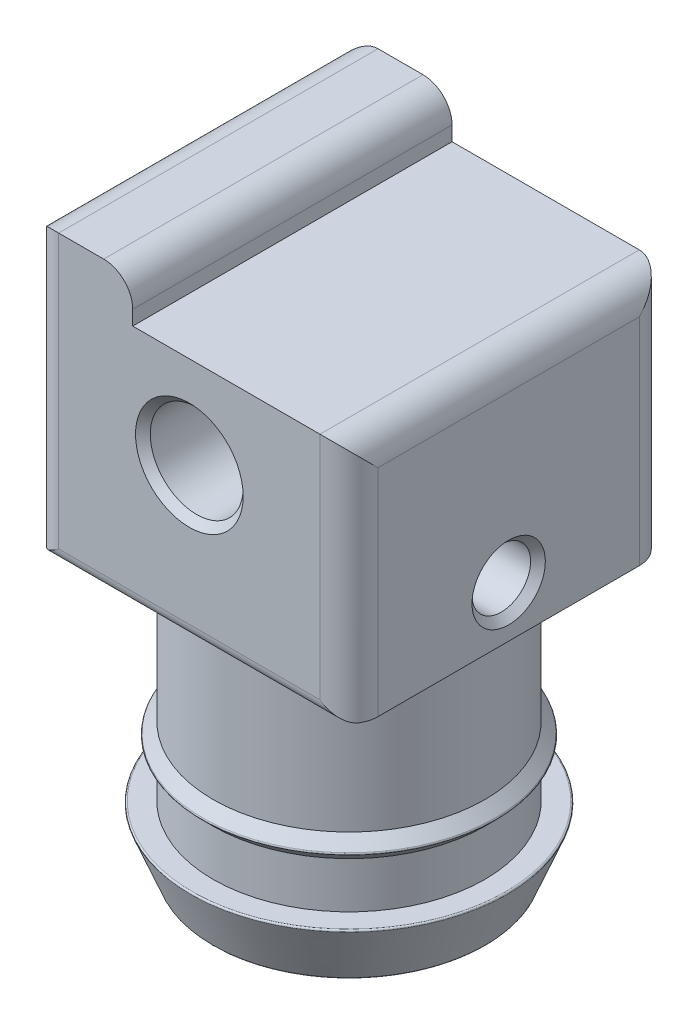
from build123d import *

# Parameters (mm, degrees)
SKETCH1_R                   = 3.2
BOSS_EXTRUDE1_DEPTH         = 11
SKETCH3_R                   = 2.38125
CUT_EXTRUDE1_DEPTH          = 25
F_10_32_TAPPED_HOLE1_REACH  = 40.409
F_10_32_TAPPED_HOLE1_BORE_R = 2.0193
FILLET3_R                   = 0.09921875
CHAMFER1_SIZE               = 0.508
FILLET6_R                   = 1
SKETCH6_W                   = 7.1
SKETCH6_H                   = 22
BOSS_EXTRUDE2_DEPTH         = 3
FILLET7_R                   = 2
FILLET8_R                   = 2


with BuildPart() as part:
    # Sketch1 → Boss-Extrude1 (new, symmetric)
    # profile 1 of 3: a face of its own
    with BuildSketch(Plane.XY):
        with BuildLine():
            Line((-11, 6.35), (-11, 0))
            Line((-11, 0), (-6.35, 0))
            ThreePointArc((-6.35, 0), (-4.49012806, 4.490128061), (2e-09, 6.35))
            Line((2e-09, 6.35), (-11, 6.35))
        make_face()
    # profile 2 of 3: a face of its own
    with BuildSketch(Plane.XY):
        with BuildLine():
            Line((-6.35, 0), (-11, 0))
            Line((-11, 0), (-11, -10.5))
            Line((-11, -10.5), (11, -10.5))
            Line((11, -10.5), (11, 0))
            Line((11, 0), (6.35, 0))
            ThreePointArc((6.35, 0), (4.490128061, 4.49012806), (2e-09, 6.35))
            ThreePointArc((2e-09, 6.35), (-4.49012806, 4.490128061), (-6.35, 0))
        make_face()
        Circle(SKETCH1_R, mode=Mode.SUBTRACT)
    # profile 3 of 3: a face of its own
    with BuildSketch(Plane.XY):
        with BuildLine():
            Line((11, 6.35), (2e-09, 6.35))
            ThreePointArc((2e-09, 6.35), (4.490128061, 4.49012806), (6.35, 0))
            Line((6.35, 0), (11, 0))
            Line((11, 0), (11, 6.35))
        make_face()
    extrude(amount=BOSS_EXTRUDE1_DEPTH, both=True)

    # Sketch2 → Revolve1 (revolve)
    with BuildSketch(Plane.XY, mode=Mode.PRIVATE) as revolve1_sk:
        Polygon((0, -10), (9.365, -10), (9.365, -20.76875), (10.15875, -21.5625), (9.365, -22.35625), (9.365, -25.53125), (10.9525, -25.53125), (9.365, -29.5), (0, -29.5), align=None)
    revolve(revolve1_sk.sketch.rotate(Axis((0, 9.54404991, 0), (0, -1, 0)), 180), axis=Axis((0, 9.54404991, 0), (0, -1, 0)))

    # Sketch3 → Cut-Extrude1 (cut)
    with BuildSketch(Plane.XZ.offset(29.5)):
        Circle(SKETCH3_R)
    extrude(amount=-CUT_EXTRUDE1_DEPTH, mode=Mode.SUBTRACT)

    # #10-32 Tapped Hole1 bore → #10-32 Tapped Hole1 (cut, up to next)
    with BuildSketch(Plane(origin=(11, 0, 0), x_dir=(0, 0, -1), z_dir=(1, 0, 0)), mode=Mode.PRIVATE) as f_10_32_tapped_hole1_sk1:
        with Locations((0, -7)):
            Circle(F_10_32_TAPPED_HOLE1_BORE_R)
    f_10_32_tapped_hole1_tool1 = extrude(f_10_32_tapped_hole1_sk1.sketch, amount=-F_10_32_TAPPED_HOLE1_REACH, mode=Mode.PRIVATE) & part.part
    add(f_10_32_tapped_hole1_tool1.solids().sort_by_distance((11, -7, 0))[0], mode=Mode.SUBTRACT)

    # Fillet3
    fillet3_edges = [part.edges().sort_by_distance(p)[0] for p in [
        (10.15875, -21.5625, 0),
        (10.9525, -25.53125, 0),
        (9.365, -29.5, 0),
        (-2.38125, -4.5, 0),
        (-2.38125, -29.5, 0),
        (1.892404965, -8.410112563, -1.445390956),
    ]]
    fillet(fillet3_edges, radius=FILLET3_R)

    # Chamfer1
    chamfer1_edges = [part.edges().sort_by_distance(p)[0] for p in [
        (-3.2, 0, 11),
        (11, -7, 2.0193),
        (-3.2, 0, -11),
    ]]
    chamfer(chamfer1_edges, length=CHAMFER1_SIZE)

    # Fillet6
    fillet6_edges = [part.edges().sort_by_distance(p)[0] for p in [
        (0, -10.5, 11),
        (0, -10.5, -11),
    ]]
    fillet(fillet6_edges, radius=FILLET6_R)

    # Sketch6 → Boss-Extrude2 (add)
    with BuildSketch(Plane(origin=(0, 6.35, 0), x_dir=(1, 0, 0), z_dir=(0, 1, 0))):
        with Locations((-7.45, 0)):
            Rectangle(SKETCH6_W, SKETCH6_H)
    extrude(amount=BOSS_EXTRUDE2_DEPTH)

    # Fillet7
    fillet7_edges = [part.edges().sort_by_distance(p)[0] for p in [
        (11, 6.35, 0),
        (-3.9, 9.35, 0),
    ]]
    fillet(fillet7_edges, radius=FILLET7_R)

    # Fillet8
    # the kernel refuses this fillet: 2 mm, written as the material it takes off along each edge
    with BuildSketch(Plane(origin=(-11, -14.5, -11), x_dir=(1, 0, 0), z_dir=(0, 1, 0)), Plane(origin=(-11, 14.35, 11), x_dir=(1, 0, 0), z_dir=(0, -1, 0))) as fillet8_piece_1:
        with BuildLine():
            CenterArc((FILLET8_R, -FILLET8_R), FILLET8_R, 90, 90)
            Line((0, -FILLET8_R), (0, 0))
            Line((0, 0), (FILLET8_R, 0))
        make_face()
    extrude(amount=28.85, mode=Mode.SUBTRACT)
    with BuildSketch(Plane(origin=(11, 9.35, -11), x_dir=(0, 0, 1), z_dir=(0, -1, 0)), Plane(origin=(11, -14.5, 11), x_dir=(0, 0, -1), z_dir=(0, 1, 0))) as fillet8_piece_2:
        with BuildLine():
            CenterArc((FILLET8_R, FILLET8_R), FILLET8_R, 180, 90)
            Line((0, FILLET8_R), (0, 0))
            Line((0, 0), (FILLET8_R, 0))
        make_face()
    extrude(amount=23.85, mode=Mode.SUBTRACT)
    with BuildSketch(Plane(origin=(-11, 9.35, -16), x_dir=(0, -1, 0), z_dir=(0, 0, 1))) as fillet8_piece_3:
        with BuildLine():
            CenterArc((FILLET8_R, FILLET8_R), FILLET8_R, 180, 90)
            Line((0, FILLET8_R), (0, 0))
            Line((0, 0), (FILLET8_R, 0))
        make_face()
    extrude(amount=32, mode=Mode.SUBTRACT)


solid = part.part
